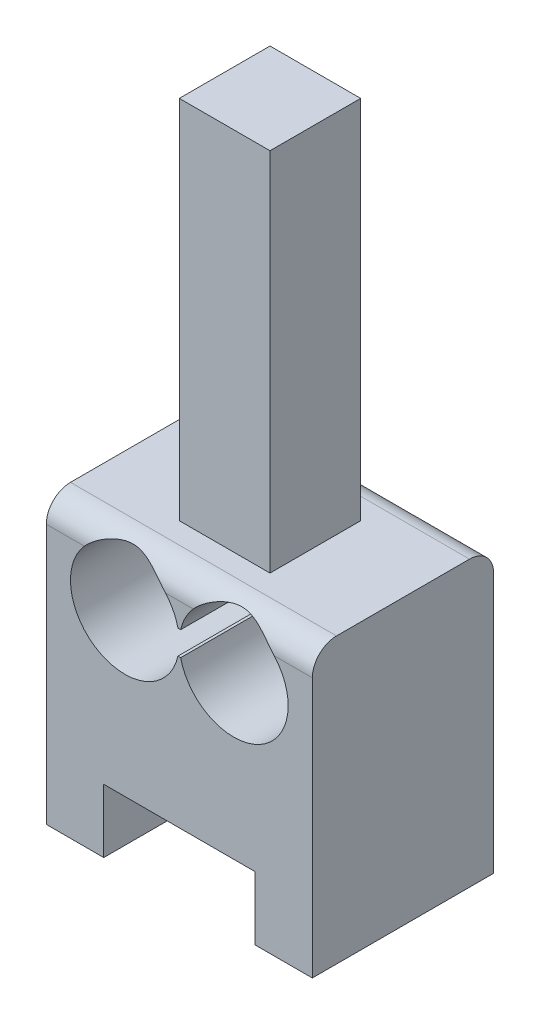
from build123d import *

# Parameters (mm, degrees)
PUSHER_BASE_DEPTH = 15
SKETCH3_R         = 1.95
SCREW_HOLE_DEPTH  = 7.5
SKETCH6_W         = 7.5
SKETCH6_H         = 30.25
PUSHER_HEAD_DEPTH = 3.75
FILLET1_R         = 2


with BuildPart() as part:
    # Sketch1 → pusher base (new body)
    with BuildSketch(Plane.XY):
        Polygon((59.166899441, -45.877477752), (51.666899441, -45.877477752), (44.666899441, -45.877477752), (37.166899441, -45.877477752), (37.166899441, -69.377477752), (41.916899441, -69.377477752), (41.916899441, -64.127477752), (54.416899441, -64.127477752), (54.416899441, -69.377477752), (59.166899441, -69.377477752), align=None)
        with BuildLine():
            Line((48.279417247, -51.877477752), (48.054381634, -51.877477752))
            ThreePointArc((48.054381634, -51.877477752), (39.166899441, -50.877477752), (48.054381634, -49.877477752))
            Line((48.054381634, -49.877477752), (48.279417247, -49.877477752))
            ThreePointArc((48.279417247, -49.877477752), (57.166899441, -50.877477752), (48.279417247, -51.877477752))
        make_face(mode=Mode.SUBTRACT)
    extrude(amount=PUSHER_BASE_DEPTH)

    # Sketch3 → screw hole (cut)
    with BuildSketch(Plane.XZ.offset(64.127477752)):
        with Locations(Location((48.166899441, 7.5, 0), (0, 0, 270))):
            Circle(SKETCH3_R)
    extrude(amount=-SCREW_HOLE_DEPTH, mode=Mode.SUBTRACT)

    # Sketch6 → pusher head (add, symmetric)
    with BuildSketch(Plane.XY.offset(7.5)):
        with Locations((48.166899441, -30.752477752)):
            Rectangle(SKETCH6_W, SKETCH6_H)
    extrude(amount=PUSHER_HEAD_DEPTH, both=True)

    # Fillet1
    # the kernel refuses this fillet: 2 mm, written as the material it takes off along each edge
    with BuildSketch(Plane(origin=(64.166899441, -45.877477752, 0), x_dir=(0, -1, 0), z_dir=(-1, 0, 0)), Plane(origin=(32.166899441, -45.877477752, 15), x_dir=(0, -1, 0), z_dir=(1, 0, 0))) as fillet1_piece_1:
        with BuildLine():
            CenterArc((FILLET1_R, FILLET1_R), FILLET1_R, 180, 90)
            Line((0, FILLET1_R), (0, 0))
            Line((0, 0), (FILLET1_R, 0))
        make_face()
    extrude(amount=32, mode=Mode.SUBTRACT)


solid = part.part
